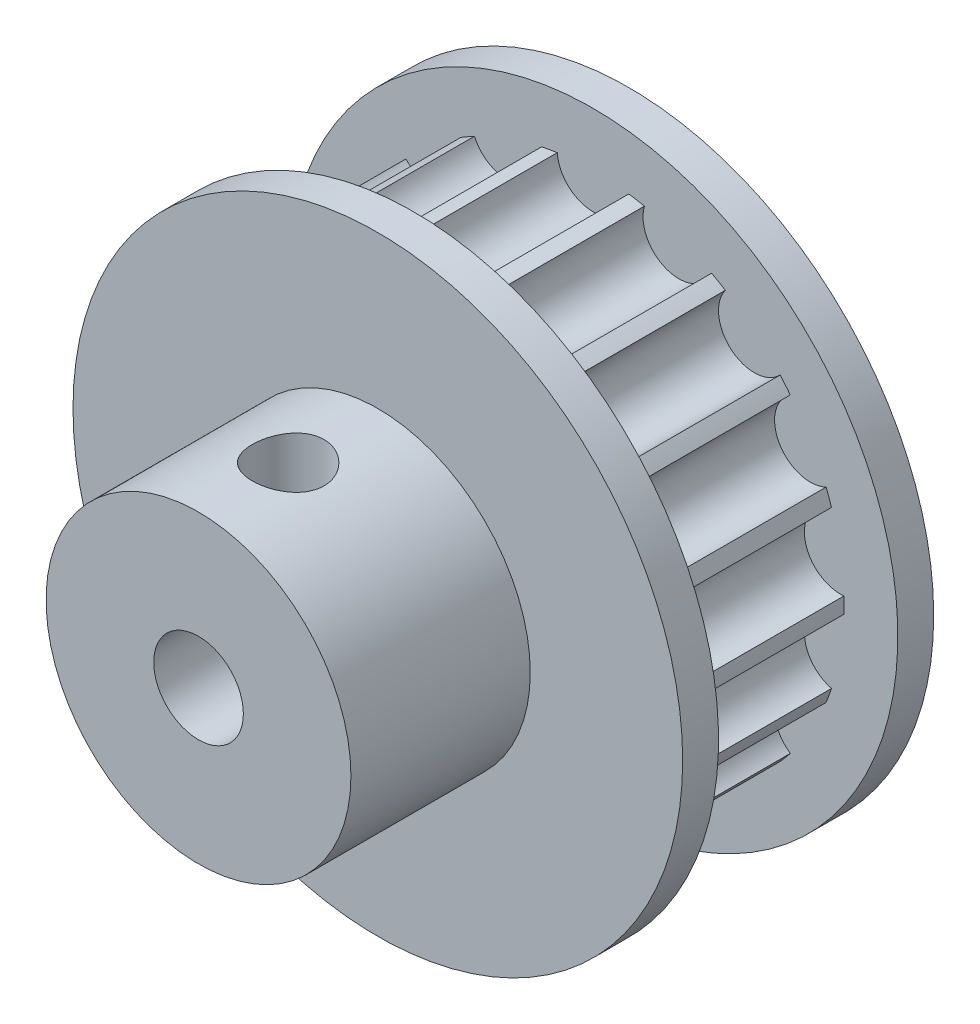
from build123d import *

# Parameters (mm, degrees)
SKETCH1_R           = 17
BOSS_EXTRUDE1_DEPTH = 14
CUT_EXTRUDE2_REACH  = 29.821
SKETCH3_R           = 2.5
BOSS_EXTRUDE2_START = 10
SKETCH5_R           = 8.5
SKETCH5_R_2         = 2.5
BOSS_EXTRUDE2_DEPTH = 10
SKETCH7_R           = 17
SKETCH7_R_2         = 14
CUT_EXTRUDE5_DEPTH  = 5
SKETCH8_R           = 2
CUT_EXTRUDE6_DEPTH  = 5
SKETCH9_R           = 2
CUT_EXTRUDE7_DEPTH  = 10


with BuildPart() as part:
    # Sketch1 → Boss-Extrude1 (new body)
    with BuildSketch(Plane.XY):
        Circle(SKETCH1_R)
    extrude(amount=BOSS_EXTRUDE1_DEPTH)

    # Sketch3 → Cut-Extrude2 (cut, up to next)
    with BuildSketch(Plane.XY.offset(14), mode=Mode.PRIVATE) as cut_extrude2_sk1:
        Circle(SKETCH3_R)
    cut_extrude2_tool1 = extrude(cut_extrude2_sk1.sketch, amount=-CUT_EXTRUDE2_REACH, mode=Mode.PRIVATE) & part.part
    add(cut_extrude2_tool1.solids().sort_by_distance((0, 0, 14))[0], mode=Mode.SUBTRACT)

    # Sketch5 → Boss-Extrude2 (add)
    with BuildSketch(Plane.XY.offset(14).offset(BOSS_EXTRUDE2_START)):
        Circle(SKETCH5_R)
        Circle(SKETCH5_R_2, mode=Mode.SUBTRACT)
    extrude(amount=-BOSS_EXTRUDE2_DEPTH)

    # Sketch7 → Cut-Extrude5 (cut, symmetric)
    with BuildSketch(Plane(origin=(0, 0, 7), x_dir=(-1, 0, 0), z_dir=(0, 0, -1))):
        Circle(SKETCH7_R)
        Circle(SKETCH7_R_2, mode=Mode.SUBTRACT)
    extrude(amount=CUT_EXTRUDE5_DEPTH, both=True, mode=Mode.SUBTRACT)

    # Sketch8 → Cut-Extrude6 (cut, symmetric)
    with BuildSketch(Plane(origin=(0, 0, 7), x_dir=(-1, 0, 0), z_dir=(0, 0, -1))):
        with Locations((0, 14)):
            Circle(SKETCH8_R)
        with Locations((4.788282007, 13.155696691)):
            Circle(SKETCH8_R)
        with Locations((8.999026536, 10.724622204)):
            Circle(SKETCH8_R)
        with Locations((12.124355653, 7)):
            Circle(SKETCH8_R)
        with Locations((13.787308542, 2.431074487)):
            Circle(SKETCH8_R)
        with Locations((13.787308542, -2.431074487)):
            Circle(SKETCH8_R)
        with Locations((12.124355653, -7)):
            Circle(SKETCH8_R)
        with Locations((8.999026536, -10.724622204)):
            Circle(SKETCH8_R)
        with Locations((4.788282007, -13.155696691)):
            Circle(SKETCH8_R)
        with Locations((0, -14)):
            Circle(SKETCH8_R)
        with Locations((-4.788282007, -13.155696691)):
            Circle(SKETCH8_R)
        with Locations((-8.999026536, -10.724622204)):
            Circle(SKETCH8_R)
        with Locations((-12.124355653, -7)):
            Circle(SKETCH8_R)
        with Locations((-13.787308542, -2.431074487)):
            Circle(SKETCH8_R)
        with Locations((-13.787308542, 2.431074487)):
            Circle(SKETCH8_R)
        with Locations((-12.124355653, 7)):
            Circle(SKETCH8_R)
        with Locations((-8.999026536, 10.724622204)):
            Circle(SKETCH8_R)
        with Locations((-4.788282007, 13.155696691)):
            Circle(SKETCH8_R)
    extrude(amount=CUT_EXTRUDE6_DEPTH, both=True, mode=Mode.SUBTRACT)

    # Sketch9 → Cut-Extrude7 (cut)
    with BuildSketch(Plane(origin=(0, 0, 0), x_dir=(1, 0, 0), z_dir=(0, 1, 0))):
        with Locations((0, -19)):
            Circle(SKETCH9_R)
    extrude(amount=CUT_EXTRUDE7_DEPTH, mode=Mode.SUBTRACT)


solid = part.part
